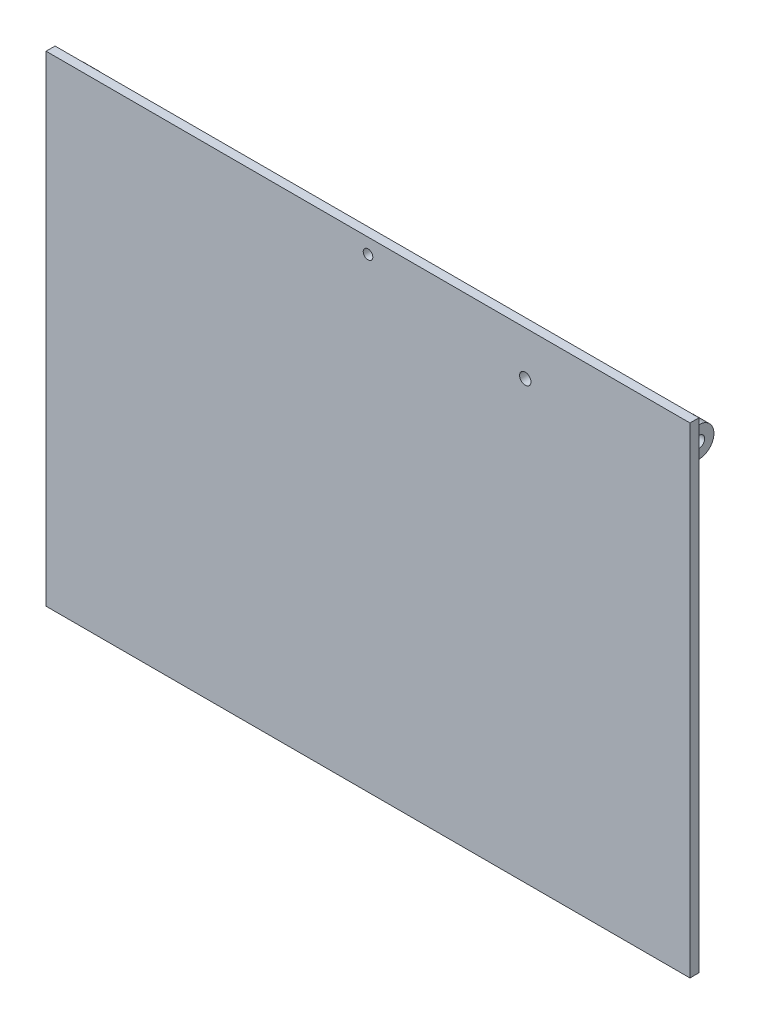
from build123d import *

# Parameters (mm, degrees)
SZKIC1_W                    = 215
SZKIC1_H                    = 160.5
DODANIE_WYCI_GNI_CIE1_DEPTH = 3
DODANIE_WYCI_GNI_CIE2_START = -3
SZKIC2_R                    = 1.9
DODANIE_WYCI_GNI_CIE2_DEPTH = 5
DODANIE_WYCI_GNI_CIE3_START = -3
SZKIC3_R                    = 1.9
DODANIE_WYCI_GNI_CIE3_DEPTH = 5
SFAZOWANIE1_SIZE            = 3
SFAZOWANIE2_START           = 8
SFAZOWANIE2_OUTLINE_R       = 1.9
SFAZOWANIE2_DEPTH           = 1.410615846
SFAZOWANIE2_START_2         = 205.589384154
SFAZOWANIE2_2_OUTLINE_R     = 1.9
SFAZOWANIE2_2_DEPTH         = 1.410615846
SFAZOWANIE2_START_3         = 10
SFAZOWANIE2_3_DEPTH         = 13
SFAZOWANIE2_START_4         = 192
SFAZOWANIE2_4_DEPTH         = 13
SFAZOWANIE2_5_OUTLINE_R     = 1.9
SFAZOWANIE2_5_DEPTH         = 148
SZKIC4_R                    = 1.6
WYTNIJ_WYCI_GNI_CIE1_DEPTH  = 10
SZKIC5_W                    = 20
SZKIC5_H                    = 5
DODANIE_WYCI_GNI_CIE4_DEPTH = 35
SZKIC6_R                    = 1.9
WYTNIJ_WYCI_GNI_CIE2_DEPTH  = 35
SFAZOWANIE3_SIZE            = 2
SZKIC7_W                    = 10
SZKIC7_H                    = 10
DODANIE_WYCI_GNI_CIE5_DEPTH = 2
SZKIC8_R                    = 1.9
WYTNIJ_WYCI_GNI_CIE3_DEPTH  = 271.32249259


with BuildPart() as part:
    # Szkic1 → Dodanie-wyciągnięcie1 (new body)
    with BuildSketch(Plane.XY):
        with Locations((107.5, 80.25)):
            Rectangle(SZKIC1_W, SZKIC1_H)
    extrude(amount=DODANIE_WYCI_GNI_CIE1_DEPTH)

    # Szkic2 → Dodanie-wyciągnięcie2 (add)
    with BuildSketch(Plane(origin=(215, 0, 0), x_dir=(0, 0, -1), z_dir=(1, 0, 0)).offset(DODANIE_WYCI_GNI_CIE2_START)):
        with BuildLine():
            Line((0, 155.5), (3.000001535, 155.5))
            ThreePointArc((3.000001535, 155.5), (8, 150.5), (3.000001535, 145.5))
            Line((3.000001535, 145.5), (0, 145.5))
            Line((0, 145.5), (0, 155.5))
        make_face()
        with Locations((3, 150.5)):
            Circle(SZKIC2_R, mode=Mode.SUBTRACT)
    dodanie_wyci_gni_cie2 = extrude(amount=-DODANIE_WYCI_GNI_CIE2_DEPTH)

    # Lustro1: Dodanie-wyciągnięcie2 across plane
    add(dodanie_wyci_gni_cie2.mirror(Plane.ZY.offset(-107.5)))

    # Szkic3 → Dodanie-wyciągnięcie3 (add)
    with BuildSketch(Plane.XZ.offset(DODANIE_WYCI_GNI_CIE3_START)):
        with BuildLine():
            Line((10, 0), (20, 0))
            Line((20, 0), (20, -3.000001569))
            ThreePointArc((20, -3.000001569), (15, -8.000001569), (10, -3.000001569))
            Line((10, -3.000001569), (10, 0))
        make_face()
        with Locations(Location((15, -3.000001569, 0), (0, 0, 270))):
            Circle(SZKIC3_R, mode=Mode.SUBTRACT)
    dodanie_wyci_gni_cie3 = extrude(amount=-DODANIE_WYCI_GNI_CIE3_DEPTH)

    # Lustro2: Dodanie-wyciągnięcie3 across plane
    add(dodanie_wyci_gni_cie3.mirror(Plane.ZY.offset(-107.5)))

    # Sfazowanie1
    sfazowanie1_edges = [part.edges().sort_by_distance(p)[0] for p in [
        (195, 5.5, 0),
        (20, 5.5, 0),
        (5.5, 145.5, 0),
        (209.5, 145.5, 0),
    ]]
    chamfer(sfazowanie1_edges, length=SFAZOWANIE1_SIZE)

    # Sfazowanie2: read off the stored shape, not the designer's step
    # Sfazowanie2 outline → Sfazowanie2 (add)
    with BuildSketch(Plane.YZ.offset(SFAZOWANIE2_START)):
        with BuildLine():
            ThreePointArc((145.5, -3.000001489), (150.499999977, -8), (155.5, -3.000001535))
            Line((155.5, -3.000001535), (155.5, 0))
            Line((155.5, 0), (142.5, 0))
            Line((142.5, 0), (145.5, -3.000001489))
        make_face()
        with Locations((150.5, -3)):
            Circle(SFAZOWANIE2_OUTLINE_R, mode=Mode.SUBTRACT)
    extrude(amount=SFAZOWANIE2_DEPTH)

    # Sfazowanie2 2 outline → Sfazowanie2 2 (add)
    with BuildSketch(Plane.YZ.offset(SFAZOWANIE2_START_2)):
        with BuildLine():
            ThreePointArc((145.5, -3.000001489), (150.499999977, -8), (155.5, -3.000001535))
            Line((155.5, -3.000001535), (155.5, 0))
            Line((155.5, 0), (142.5, 0))
            Line((142.5, 0), (145.5, -3.000001489))
        make_face()
        with Locations((150.5, -3)):
            Circle(SFAZOWANIE2_2_OUTLINE_R, mode=Mode.SUBTRACT)
    extrude(amount=SFAZOWANIE2_2_DEPTH)

    # Sfazowanie2 3 outline → Sfazowanie2 3 (add)
    with BuildSketch(Plane.YZ.offset(SFAZOWANIE2_START_3)):
        Polygon((8, -8), (9.410615846, 0), (8, 0), align=None)
    extrude(amount=SFAZOWANIE2_3_DEPTH)

    # Sfazowanie2 4 outline → Sfazowanie2 4 (add)
    with BuildSketch(Plane.YZ.offset(SFAZOWANIE2_START_4)):
        Polygon((8, -8), (9.410615846, 0), (8, 0), align=None)
    extrude(amount=SFAZOWANIE2_4_DEPTH)

    # Sfazowanie2 5 outline → Sfazowanie2 5 (cut)
    with BuildSketch(Plane(origin=(0, 0, 0), x_dir=(1, 0, 0), z_dir=(0, 1, 0)).offset(SFAZOWANIE2_START)):
        with BuildLine():
            Line((10, 10), (10, 3.000001569))
            ThreePointArc((10, 3.000001569), (15.000000024, 8.000001569), (20, 3.000001521))
            Line((20, 3.000001521), (23, 0))
            Line((23, 0), (23, 10))
            Line((23, 10), (10, 10))
        make_face()
        Polygon((9.410615846, 0), (9.410615846, 10), (7.647346039, 10), (8, 8), align=None)
        with BuildLine():
            Line((205, 10), (192, 10))
            Line((192, 10), (192, 0))
            Line((192, 0), (195, 3.000001521))
            ThreePointArc((195, 3.000001521), (199.999999976, 8.000001569), (205, 3.000001569))
            Line((205, 3.000001569), (205, 10))
        make_face()
        Polygon((207.352653962, 10), (205.589384154, 10), (205.589384154, 0), (207, 8), align=None)
        with Locations((15, 3.000001569)):
            Circle(SFAZOWANIE2_5_OUTLINE_R)
        with Locations((200, 3.000001569)):
            Circle(SFAZOWANIE2_5_OUTLINE_R)
    extrude(amount=SFAZOWANIE2_5_DEPTH, mode=Mode.SUBTRACT)

    # Szkic4 → Wytnij-wyciągnięcie1 (cut)
    with BuildSketch(Plane(origin=(0, 0, 0), x_dir=(-1, 0, 0), z_dir=(0, 0, -1))):
        with Locations((-107.5, 155.5)):
            Circle(SZKIC4_R)
    extrude(amount=-WYTNIJ_WYCI_GNI_CIE1_DEPTH, mode=Mode.SUBTRACT)

    # Szkic5 → Dodanie-wyciągnięcie4 (add)
    with BuildSketch(Plane(origin=(0, 0, 0), x_dir=(-1, 0, 0), z_dir=(0, 0, -1))):
        with Locations((-107.5, 5.5)):
            Rectangle(SZKIC5_W, SZKIC5_H)
    extrude(amount=DODANIE_WYCI_GNI_CIE4_DEPTH)

    # Szkic6 → Wytnij-wyciągnięcie2 (cut)
    with BuildSketch(Plane(origin=(0, 8, 0), x_dir=(1, 0, 0), z_dir=(0, 1, 0))):
        with Locations(Location((107.5, 15, 0), (0, 0, 270))):
            Circle(SZKIC6_R)
    extrude(amount=-WYTNIJ_WYCI_GNI_CIE2_DEPTH, mode=Mode.SUBTRACT)

    # Sfazowanie3
    sfazowanie3_edges = [part.edges().sort_by_distance(p)[0] for p in [
        (117.5, 5.5, 0),
        (97.5, 5.5, 0),
        (107.5, 8, 0),
    ]]
    chamfer(sfazowanie3_edges, length=SFAZOWANIE3_SIZE)

    # Szkic7 → Dodanie-wyciągnięcie5 (add)
    with BuildSketch(Plane(origin=(0, 0, 0), x_dir=(-1, 0, 0), z_dir=(0, 0, -1))):
        with Locations((-160, 145.8)):
            Rectangle(SZKIC7_W, SZKIC7_H)
    extrude(amount=DODANIE_WYCI_GNI_CIE5_DEPTH)

    # Szkic8 → Wytnij-wyciągnięcie3 (cut, through all)
    with BuildSketch(Plane(origin=(0, 0, -2), x_dir=(-1, 0, 0), z_dir=(0, 0, -1))):
        with Locations((-160, 145.8)):
            Circle(SZKIC8_R)
    extrude(amount=-WYTNIJ_WYCI_GNI_CIE3_DEPTH, mode=Mode.SUBTRACT)


solid = part.part
